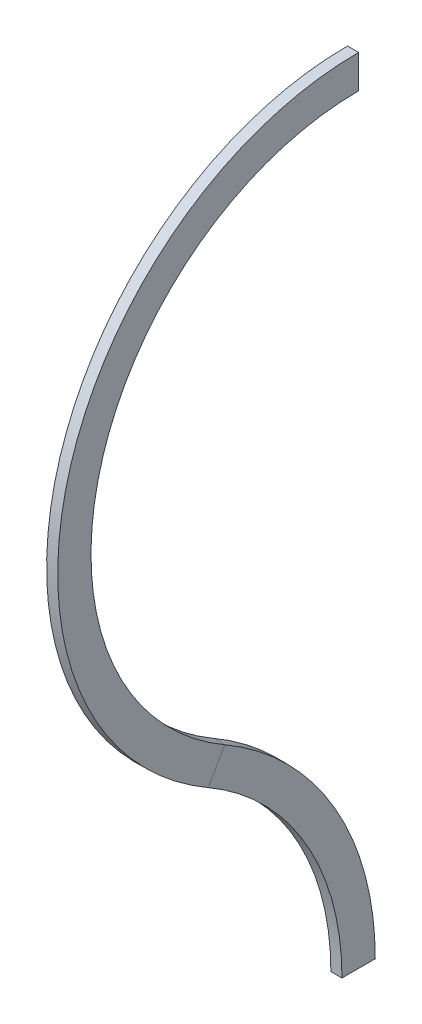
from build123d import *

# Parameters (mm, degrees)
SKETCH2_W = 2
SKETCH2_H = 6


with BuildPart() as part:
    # Sweep1: sweep along a path in Sketch1
    with BuildLine(Plane(origin=(0, 0, 0), x_dir=(0, 0, -1), z_dir=(1, 0, 0))) as sweep1_path:
        ThreePointArc((0, 140), (-49.497474683, 102.019251839), (-25.621778265, 44.378221735))
        ThreePointArc((-25.621778265, 44.378221735), (-6.865334795, 25.621778265), (0, 0))
    # Sketch2 → Sweep1 (sweep)
    with BuildSketch(Plane(origin=(0, 0, 0), x_dir=(1, 0, 0), z_dir=(0, 1, 0))):
        with Locations((1, 0)):
            Rectangle(SKETCH2_W, SKETCH2_H)
    sweep(path=sweep1_path.line)


solid = part.part
